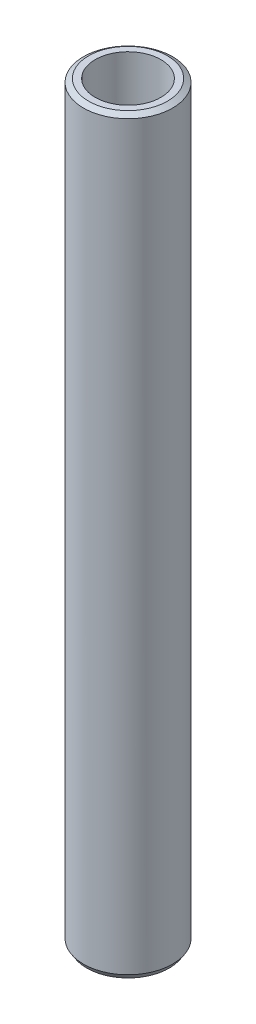
from build123d import *
from OCP.BRepFilletAPI import BRepFilletAPI_MakeChamfer

# Parameters (mm, degrees)
SKETCH1_R           = 20
BOSS_EXTRUDE1_DEPTH = 336.498548135
SKETCH2_R           = 14.723411513
CUT_EXTRUDE1_DEPTH  = 338.685168311
CHAMFER1_SIZE       = 1.501588445
CHAMFER1_SIZE2      = 2.329116287


with BuildPart() as part:
    # Sketch1 → Boss-Extrude1 (new body)
    with BuildSketch(Plane(origin=(0, 0, 0), x_dir=(1, 0, 0), z_dir=(0, 1, 0))):
        Circle(SKETCH1_R)
    extrude(amount=BOSS_EXTRUDE1_DEPTH)

    # Sketch2 → Cut-Extrude1 (cut, through all)
    with BuildSketch(Plane(origin=(0, 0, 0), x_dir=(1, 0, 0), z_dir=(0, 1, 0))):
        Circle(SKETCH2_R)
    extrude(amount=CUT_EXTRUDE1_DEPTH, mode=Mode.SUBTRACT)

    # Chamfer1: one chamfer whose edges measure the first distance from different faces: ONE call of the kernel's chamfer builder (chamfer() names one face for all edges)
    chamfer1_edges_1 = [part.edges().sort_by_distance(p)[0] for p in [
        (-20, 336.498548135, 0),
    ]]
    chamfer1_side_1 = [part.faces().sort_by_distance(p)[0] for p in [
        (-20, 168.249274067, 0),
    ]]
    chamfer1_edges_2 = [part.edges().sort_by_distance(p)[0] for p in [
        (-20, 0, 0),
    ]]
    chamfer1_side_2 = [part.faces().sort_by_distance(p)[0] for p in [
        (-19.434314575, 0, 0),
    ]]
    chamfer1 = BRepFilletAPI_MakeChamfer(part.part.solid().wrapped)
    for e in chamfer1_edges_1:
        chamfer1.Add(CHAMFER1_SIZE, CHAMFER1_SIZE2, e.wrapped, chamfer1_side_1[0].wrapped)  # the first distance lies on this face
    for e in chamfer1_edges_2:
        chamfer1.Add(CHAMFER1_SIZE, CHAMFER1_SIZE2, e.wrapped, chamfer1_side_2[0].wrapped)  # the first distance lies on this face
    add(Compound.cast(chamfer1.Shape()), mode=Mode.REPLACE)


solid = part.part
